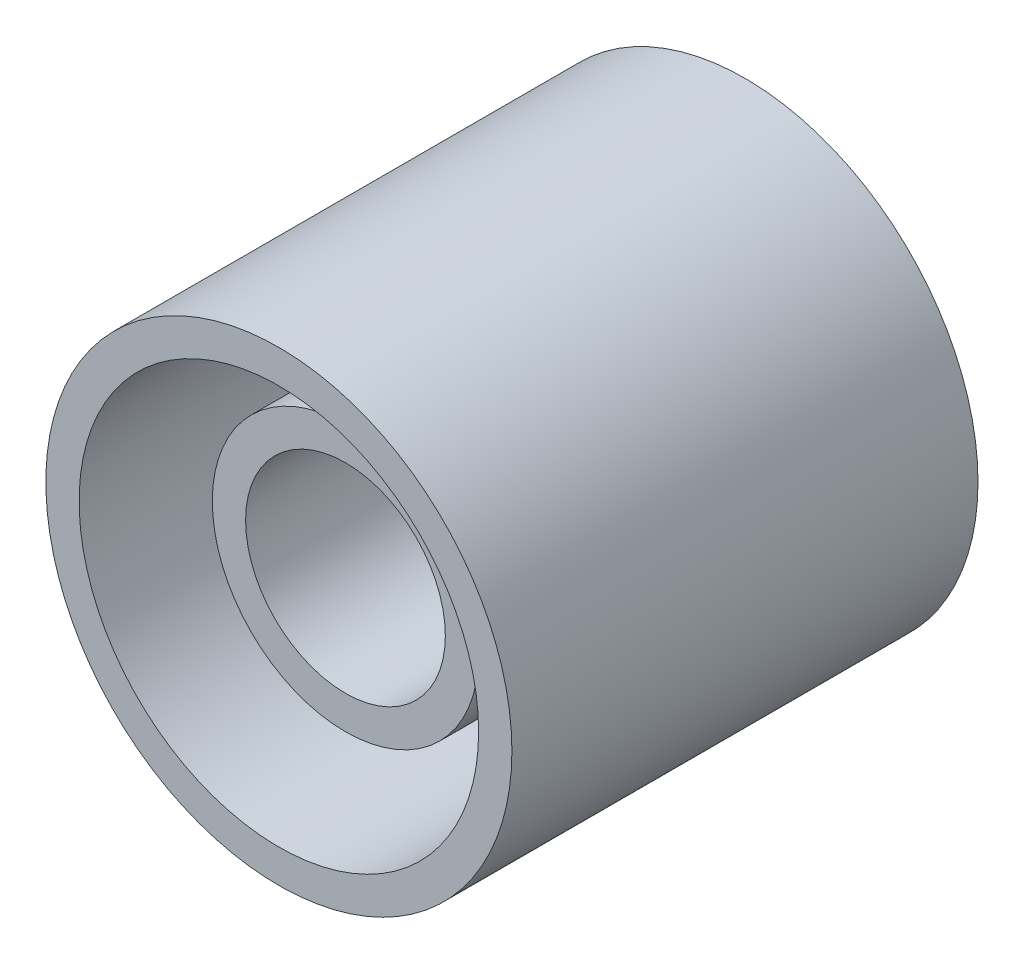
from build123d import *

# Parameters (mm, degrees)
SKETCH3_R           = 1.75
BOSS_EXTRUDE1_DEPTH = 3.5
SKETCH4_R           = 0.75
CUT_EXTRUDE1_DEPTH  = 3
SKETCH6_R           = 1.5
SKETCH6_R_2         = 1
CUT_EXTRUDE6_DEPTH  = 3
SKETCH10_R          = 1
CUT_EXTRUDE7_DEPTH  = 0.5
CUT_EXTRUDE8_START  = -0.3
SKETCH12_R          = 1.5
CUT_EXTRUDE8_DEPTH  = 0.3


with BuildPart() as part:
    # Sketch3 → Boss-Extrude1 (new body)
    with BuildSketch(Plane.XY):
        Circle(SKETCH3_R)
    extrude(amount=BOSS_EXTRUDE1_DEPTH)

    # Sketch4 → Cut-Extrude1 (cut)
    with BuildSketch(Plane.XY.offset(3.5)):
        Circle(SKETCH4_R)
    extrude(amount=-CUT_EXTRUDE1_DEPTH, mode=Mode.SUBTRACT)

    # Sketch6 → Cut-Extrude6 (cut)
    with BuildSketch(Plane.XY.offset(3.5)):
        Circle(SKETCH6_R)
        Circle(SKETCH6_R_2, mode=Mode.SUBTRACT)
    extrude(amount=-CUT_EXTRUDE6_DEPTH, mode=Mode.SUBTRACT)

    # Sketch10 → Cut-Extrude7 (cut)
    with BuildSketch(Plane.XY.offset(3.5)):
        Circle(SKETCH10_R)
    extrude(amount=-CUT_EXTRUDE7_DEPTH, mode=Mode.SUBTRACT)

    # Sketch12 → Cut-Extrude8 (cut)
    with BuildSketch(Plane(origin=(0, 0, 0), x_dir=(-1, 0, 0), z_dir=(0, 0, -1)).offset(CUT_EXTRUDE8_START)):
        Circle(SKETCH12_R)
    extrude(amount=CUT_EXTRUDE8_DEPTH, mode=Mode.SUBTRACT)


solid = part.part
